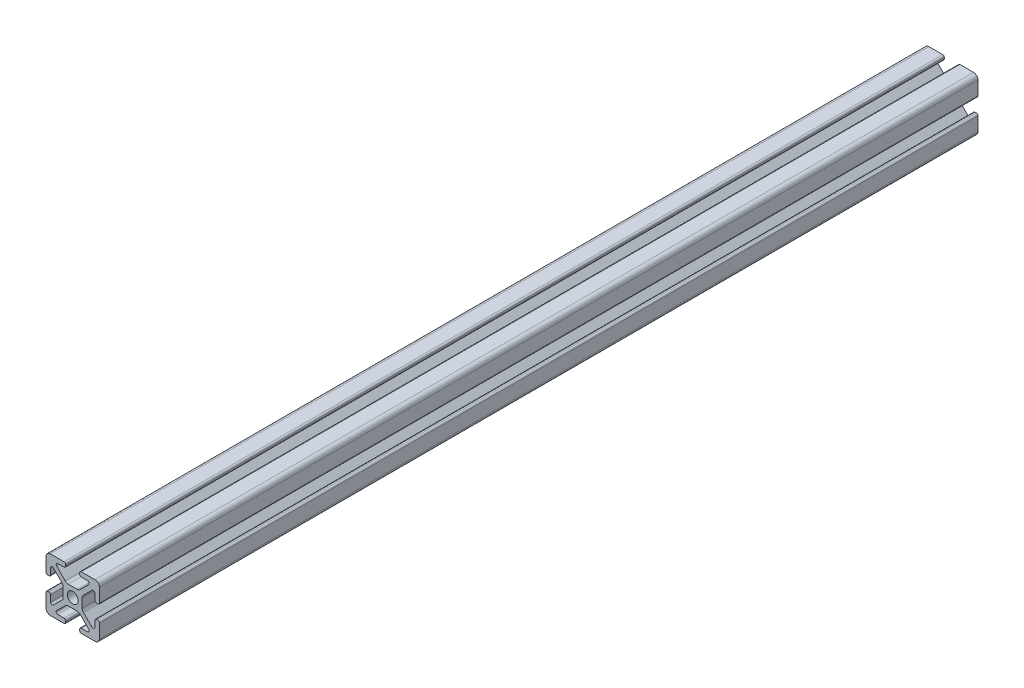
from build123d import *

# Parameters (mm, degrees)
SKETCH2_W            = 8.76
SKETCH2_H            = 8.76
SKETCH2_R            = 2.5
BOSS_EXTRUDE1_DEPTH  = 203.2
BOSS_EXTRUDE2_START  = -203.2
BOSS_EXTRUDE2_DEPTH  = 406.4
FILLET1_R            = 0.75
FILLET1_OF_MIRROR1_R = 0.75
MIRROR2_START        = -203.2
MIRROR2_DEPTH        = 406.4
FILLET2_R            = 2


# Read off the part's stored shape, not the designer's step: Mirror2
with BuildPart() as part:
    # Sketch2 → Boss-Extrude1 (new, symmetric)
    with BuildSketch(Plane.XY):
        Rectangle(SKETCH2_W, SKETCH2_H)
        Circle(SKETCH2_R, mode=Mode.SUBTRACT)
    extrude(amount=BOSS_EXTRUDE1_DEPTH, both=True)

    # Sketch3 → Boss-Extrude2 (add)
    with BuildSketch(Plane.XY.offset(BOSS_EXTRUDE2_START)):
        Polygon((3.25, 12.35), (12.35, 12.35), (12.35, 3.25), (10.22, 3.25), (10.22, 8.713862556), (4.38, 2.873862556), (4.38, 4.38), (2.873862556, 4.38), (8.713862556, 10.22), (3.25, 10.22), align=None)
    boss_extrude2 = extrude(amount=BOSS_EXTRUDE2_DEPTH)

    # Fillet1
    fillet1_edges = [part.edges().sort_by_distance(p)[0] for p in [
        (3.25, 12.35, 0),
        (3.25, 10.22, 0),
        (8.713862556, 10.22, 0),
        (10.22, 8.713862556, 0),
        (10.22, 3.25, 0),
        (12.35, 3.25, 0),
    ]]
    fillet(fillet1_edges, radius=FILLET1_R)

    # Mirror1: Boss-Extrude2 across plane
    add(boss_extrude2.mirror(Plane.ZX))

    # Fillet1 of Mirror1
    fillet1_of_mirror1_edges = [part.edges().sort_by_distance(p)[0] for p in [
        (3.25, -12.35, 0),
        (3.25, -10.22, 0),
        (8.713862556, -10.22, 0),
        (10.22, -8.713862556, 0),
        (10.22, -3.25, 0),
        (12.35, -3.25, 0),
    ]]
    fillet(fillet1_of_mirror1_edges, radius=FILLET1_OF_MIRROR1_R)

    # Mirror2 outline → Mirror2 (add)
    with BuildSketch(Plane.XY.offset(MIRROR2_START)):
        with BuildLine():
            ThreePointArc((-7.43353247, 8.939669914), (-7.596112034, 9.757012574), (-6.903202384, 10.22))
            Line((-6.903202384, 10.22), (-4, 10.22))
            ThreePointArc((-4, 10.22), (-3.469669914, 10.439669914), (-3.25, 10.97))
            Line((-3.25, 10.97), (-3.25, 11.6))
            ThreePointArc((-3.25, 11.6), (-3.469669914, 12.130330086), (-4, 12.35))
            Line((-4, 12.35), (-12.35, 12.35))
            Line((-12.35, 12.35), (-12.35, 4))
            ThreePointArc((-12.35, 4), (-12.130330086, 3.469669914), (-11.6, 3.25))
            Line((-11.6, 3.25), (-10.97, 3.25))
            ThreePointArc((-10.97, 3.25), (-10.439669914, 3.469669914), (-10.22, 4))
            Line((-10.22, 4), (-10.22, 6.903202384))
            ThreePointArc((-10.22, 6.903202384), (-9.757012574, 7.596112034), (-8.939669914, 7.43353247))
            Line((-8.939669914, 7.43353247), (-4.38, 2.873862556))
            Line((-4.38, 2.873862556), (-4.38, 4.38))
            Line((-4.38, 4.38), (-2.873862556, 4.38))
            Line((-2.873862556, 4.38), (-7.43353247, 8.939669914))
        make_face()
        with BuildLine():
            Line((-4.38, -4.38), (-4.38, -2.873862556))
            Line((-4.38, -2.873862556), (-8.939669914, -7.43353247))
            ThreePointArc((-8.939669914, -7.43353247), (-9.757012574, -7.596112034), (-10.22, -6.903202384))
            Line((-10.22, -6.903202384), (-10.22, -4))
            ThreePointArc((-10.22, -4), (-10.439669914, -3.469669914), (-10.97, -3.25))
            Line((-10.97, -3.25), (-11.6, -3.25))
            ThreePointArc((-11.6, -3.25), (-12.130330086, -3.469669914), (-12.35, -4))
            Line((-12.35, -4), (-12.35, -12.35))
            Line((-12.35, -12.35), (-4, -12.35))
            ThreePointArc((-4, -12.35), (-3.469669914, -12.130330086), (-3.25, -11.6))
            Line((-3.25, -11.6), (-3.25, -10.97))
            ThreePointArc((-3.25, -10.97), (-3.469669914, -10.439669914), (-4, -10.22))
            Line((-4, -10.22), (-6.903202384, -10.22))
            ThreePointArc((-6.903202384, -10.22), (-7.596112034, -9.757012574), (-7.43353247, -8.939669914))
            Line((-7.43353247, -8.939669914), (-2.873862556, -4.38))
            Line((-2.873862556, -4.38), (-4.38, -4.38))
        make_face()
    extrude(amount=MIRROR2_DEPTH)

    # Fillet2
    fillet2_edges = [part.edges().sort_by_distance(p)[0] for p in [
        (-2.873862556, -4.38, 0),
        (-4.38, -2.873862556, 0),
        (-12.35, -12.35, 0),
        (2.873862556, 4.38, 0),
        (4.38, 2.873862556, 0),
        (12.35, 12.35, 0),
        (-2.873862556, 4.38, 0),
        (-4.38, 2.873862556, 0),
        (-12.35, 12.35, 0),
        (2.873862556, -4.38, 0),
        (4.38, -2.873862556, 0),
        (12.35, -12.35, 0),
    ]]
    fillet(fillet2_edges, radius=FILLET2_R)


solid = part.part
